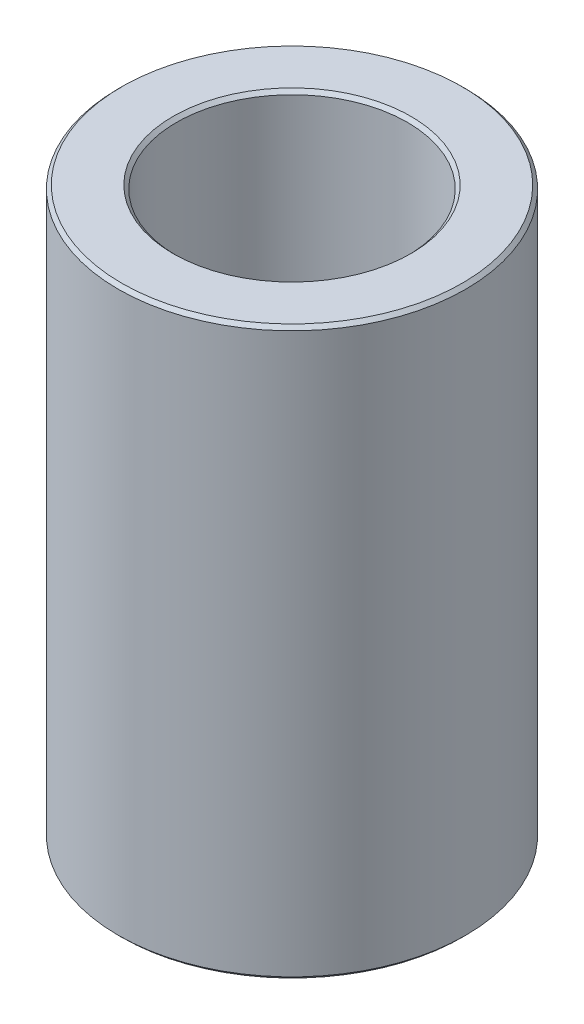
from build123d import *

# Parameters (mm, degrees)
SKETCH1_R           = 52.5
BOSS_EXTRUDE1_DEPTH = 171.215724514
SKETCH2_R           = 34.898194412
CUT_EXTRUDE1_DEPTH  = 187.620803558
CHAMFER1_SIZE       = 1.049986753


with BuildPart() as part:
    # Sketch1 → Boss-Extrude1 (new body)
    with BuildSketch(Plane(origin=(0, 0, 0), x_dir=(1, 0, 0), z_dir=(0, 1, 0))):
        Circle(SKETCH1_R)
    extrude(amount=BOSS_EXTRUDE1_DEPTH)

    # Sketch2 → Cut-Extrude1 (cut, through all)
    with BuildSketch(Plane(origin=(0, 0, 0), x_dir=(1, 0, 0), z_dir=(0, 1, 0))):
        Circle(SKETCH2_R)
    extrude(amount=CUT_EXTRUDE1_DEPTH, mode=Mode.SUBTRACT)

    # Chamfer1
    chamfer1_edges = [part.edges().sort_by_distance(p)[0] for p in [
        (-34.898194412, 171.215724514, 0),
        (-34.898194412, 0, 0),
        (-52.5, 0, 0),
        (-52.5, 171.215724514, 0),
    ]]
    chamfer(chamfer1_edges, length=CHAMFER1_SIZE)


solid = part.part
